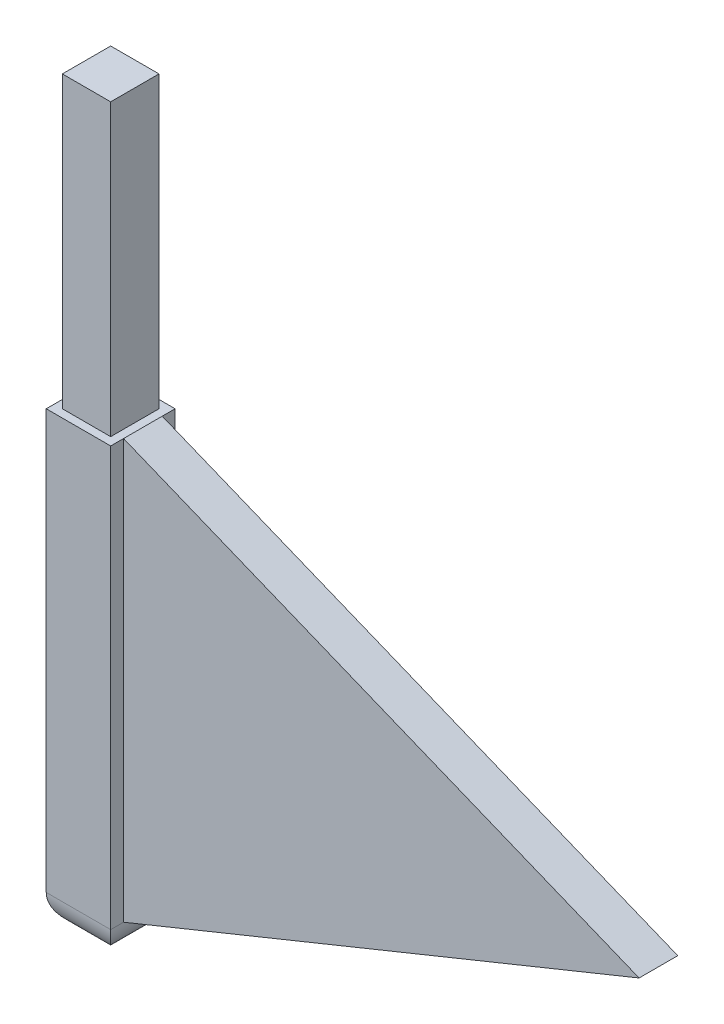
from build123d import *

# Parameters (mm, degrees)
SKETCH1_W           = 2.54
SKETCH1_H           = 2.54
BOSS_EXTRUDE1_DEPTH = 29.21
SKETCH2_OUTSIDE_W   = 10.426
SKETCH2_OUTSIDE_H   = 10.426
SKETCH2_OUTSIDE_W_2 = 1.905
SKETCH2_OUTSIDE_H_2 = 1.905
CUT_EXTRUDE1_DEPTH  = 11.43
FILLET1_R           = 1.27
SKETCH3_W           = 1.524
SKETCH3_H           = 16.51
BOSS_EXTRUDE2_DEPTH = 20.32
CUT_EXTRUDE2_DEPTH  = 38.147445726
CUT_EXTRUDE3_DEPTH  = 38.147445726


with BuildPart() as part:
    # Sketch1 → Boss-Extrude1 (new body)
    with BuildSketch(Plane(origin=(0, 0, 0), x_dir=(1, 0, 0), z_dir=(0, 1, 0))):
        with Locations((1.27, 1.27)):
            Rectangle(SKETCH1_W, SKETCH1_H)
    extrude(amount=BOSS_EXTRUDE1_DEPTH)

    # Sketch2 outside → Cut-Extrude1 (cut)
    with BuildSketch(Plane(origin=(0, 29.21, 0), x_dir=(1, 0, 0), z_dir=(0, 1, 0))):
        with Locations((1.27, 1.27)):
            Rectangle(SKETCH2_OUTSIDE_W, SKETCH2_OUTSIDE_H)
        with Locations((1.27, 1.27)):
            Rectangle(SKETCH2_OUTSIDE_W_2, SKETCH2_OUTSIDE_H_2, mode=Mode.SUBTRACT)
    extrude(amount=-CUT_EXTRUDE1_DEPTH, mode=Mode.SUBTRACT)

    # Fillet1
    fillet1_edges = [part.edges().sort_by_distance(p)[0] for p in [
        (1.27, 0, -2.54),
        (2.54, 0, -1.27),
        (1.27, 0, 0),
        (0, 0, -1.27),
    ]]
    fillet(fillet1_edges, radius=FILLET1_R - 0.0001)  # a hair under: the kernel refuses the full size

    # Sketch3 → Boss-Extrude2 (add)
    with BuildSketch(Plane(origin=(2.54, 0, 0), x_dir=(0, 0, -1), z_dir=(1, 0, 0))):
        with Locations((1.27, 9.525)):
            Rectangle(SKETCH3_W, SKETCH3_H)
    extrude(amount=BOSS_EXTRUDE2_DEPTH)

    # Sketch4 → Cut-Extrude2 (cut, through all)
    with BuildSketch(Plane.XY.offset(-0.508)):
        Polygon((2.54, 17.78), (22.86, 9.525), (22.86, 17.78), align=None)
    extrude(amount=-CUT_EXTRUDE2_DEPTH, mode=Mode.SUBTRACT)

    # Sketch5 → Cut-Extrude3 (cut, through all)
    with BuildSketch(Plane.XY.offset(-0.508)):
        Polygon((2.54, 1.27), (22.86, 9.525), (22.86, 1.27), align=None)
    extrude(amount=-CUT_EXTRUDE3_DEPTH, mode=Mode.SUBTRACT)


solid = part.part
